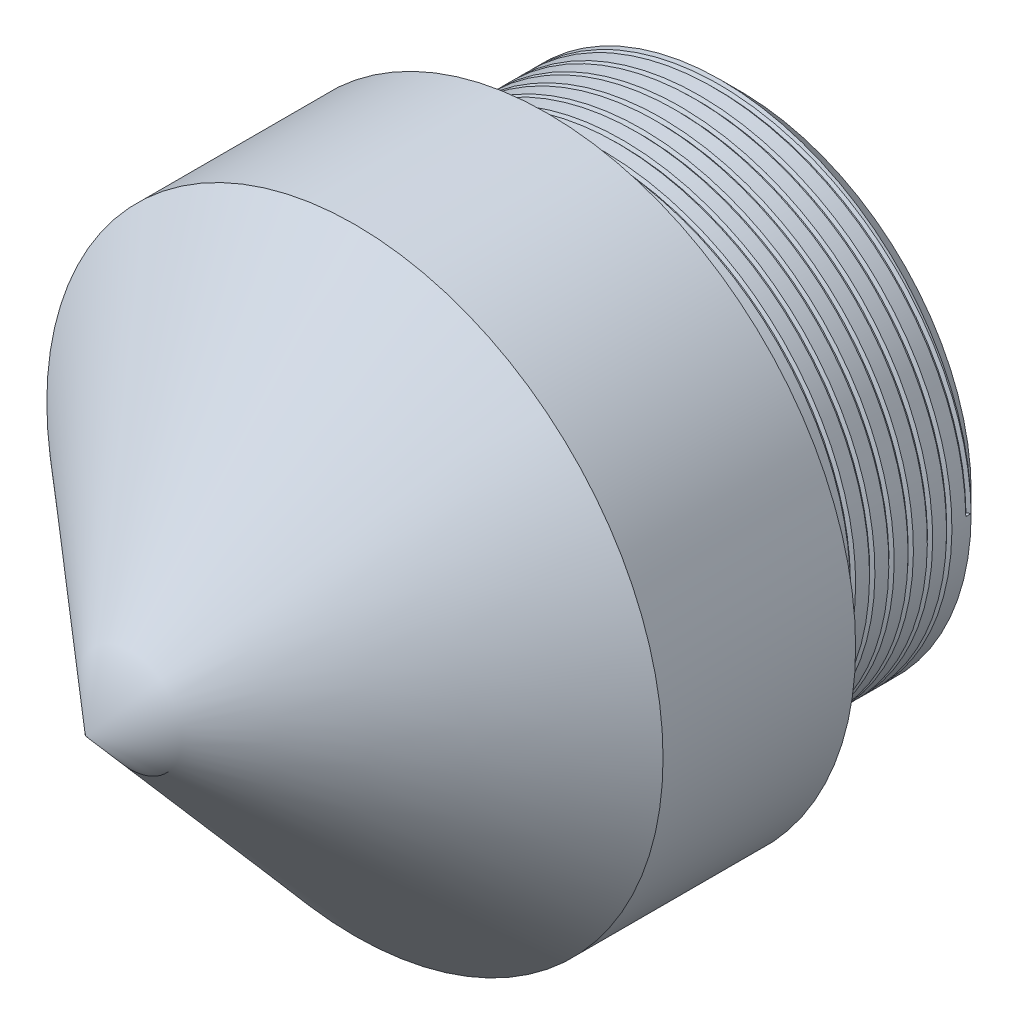
from build123d import *

# Parameters (mm, degrees)
IZIM2_R                     = 13
Y_KSEKLIK_EKSTR_ZYON1_DEPTH = 10
IZIM3_R                     = 16
Y_KSEKLIK_EKSTR_ZYON2_DEPTH = 10
PAH1_SIZE                   = 1
DI_1_PITCH                  = 1
IZIM5_R                     = 11.2
KES_EKSTR_ZYON1_DEPTH       = 10
IZIM6_R                     = 1
KES_EKSTR_ZYON2_DEPTH       = 8


# Read off the part's stored shape, not the designer's step: Loft1
with BuildPart() as part:
    # Çizim2 → Yükseklik-Ekstrüzyon1 (new body)
    with BuildSketch(Plane.XY):
        Circle(IZIM2_R)
    extrude(amount=Y_KSEKLIK_EKSTR_ZYON1_DEPTH)

    # Çizim3 → Yükseklik-Ekstrüzyon2 (add)
    with BuildSketch(Plane.XY.offset(10)):
        Circle(IZIM3_R)
    extrude(amount=Y_KSEKLIK_EKSTR_ZYON2_DEPTH)

    # Loft1 outline → Loft1 (revolve)
    with BuildSketch(Plane.XZ):
        Polygon((16, 20), (0, 34), (0, 20), align=None)
    revolve(axis=Axis((0, 0, 0), (0, 0, 1)))

    # Pah1
    pah1_edges = [part.edges().sort_by_distance(p)[0] for p in [
        (-13, 0, 0),
    ]]
    chamfer(pah1_edges, length=PAH1_SIZE)

    # Diş1: the profile of Diş Profili1 profile screwed along a right-hand helix of 10 turns, 8 arcs to a turn; built about Z, then put on its axis
    di_1_z = Axis((0, 0, 0), (0, 0, 1))
    di_1_corners = [(13.0003, 0, -0.000173205), (13.0003, 0, 0.277985704), (12.828148085, 0, 0.17859375), (12.828148085, 0, 0.09921875)]
    with BuildLine(mode=Mode.PRIVATE) as di_1_profile:
        Line(di_1_corners[0], di_1_corners[1])
        Line(di_1_corners[1], di_1_corners[2])
        Line(di_1_corners[2], di_1_corners[3])
        Line(di_1_corners[3], di_1_corners[0])
    di_1_cap = Face(di_1_profile.wire())
    di_1_turn_angles = [0, 22.5, 45, 67.5, 90, 112.5, 135, 157.5, 180, 202.5, 225, 247.5, 270, 292.5, 315, 337.5, 360]
    di_1_turn_weights = [1, 0.9238795325112867, 1, 0.9238795325112867, 1, 0.9238795325112867, 1, 0.9238795325112867, 1, 0.9238795325112867, 1, 0.9238795325112867, 1, 0.9238795325112867, 1, 0.9238795325112867, 1]
    di_1_turn_rails = [Edge.make_bspline([Vector(p[0], p[1], 0).rotate(di_1_z, di_1_turn_angles[k]) / di_1_turn_weights[k] + Vector(0, 0, p[2] + DI_1_PITCH * di_1_turn_angles[k] / 360) for k in range(17)], [0, 0, 0, 1, 1, 2, 2, 3, 3, 4, 4, 5, 5, 6, 6, 7, 7, 8, 8, 8], 2, di_1_turn_weights) for p in di_1_corners]
    di_1_turn_sides = [Face.make_surface_from_curves(di_1_turn_rails[p[0]], di_1_turn_rails[p[1]]) for p in [(0, 1), (1, 2), (2, 3), (3, 0)]]
    di_1 = Plane(origin=(0, 0, 1), x_dir=(1, 0, 0), z_dir=(0, 0, 1)) * Solid(Shell([*[p.moved(Location((0, 0, DI_1_PITCH * i))) for i in range(10) for p in di_1_turn_sides], di_1_cap, di_1_cap.rotate(di_1_z, 3600).moved(Location((0, 0, DI_1_PITCH * 3600 / 360)))]))
    add(di_1, mode=Mode.SUBTRACT)

    # Çizim5 → Kes-Ekstrüzyon1 (cut)
    with BuildSketch(Plane(origin=(0, 0, 0), x_dir=(-1, 0, 0), z_dir=(0, 0, -1))):
        Circle(IZIM5_R)
    extrude(amount=-KES_EKSTR_ZYON1_DEPTH, mode=Mode.SUBTRACT)

    # Çizim6 → Kes-Ekstrüzyon2 (cut)
    with BuildSketch(Plane(origin=(0, 0, 10), x_dir=(-1, 0, 0), z_dir=(0, 0, -1))):
        with Locations((0, 9.58478495)):
            Circle(IZIM6_R)
    extrude(amount=-KES_EKSTR_ZYON2_DEPTH, mode=Mode.SUBTRACT)


solid = part.part
